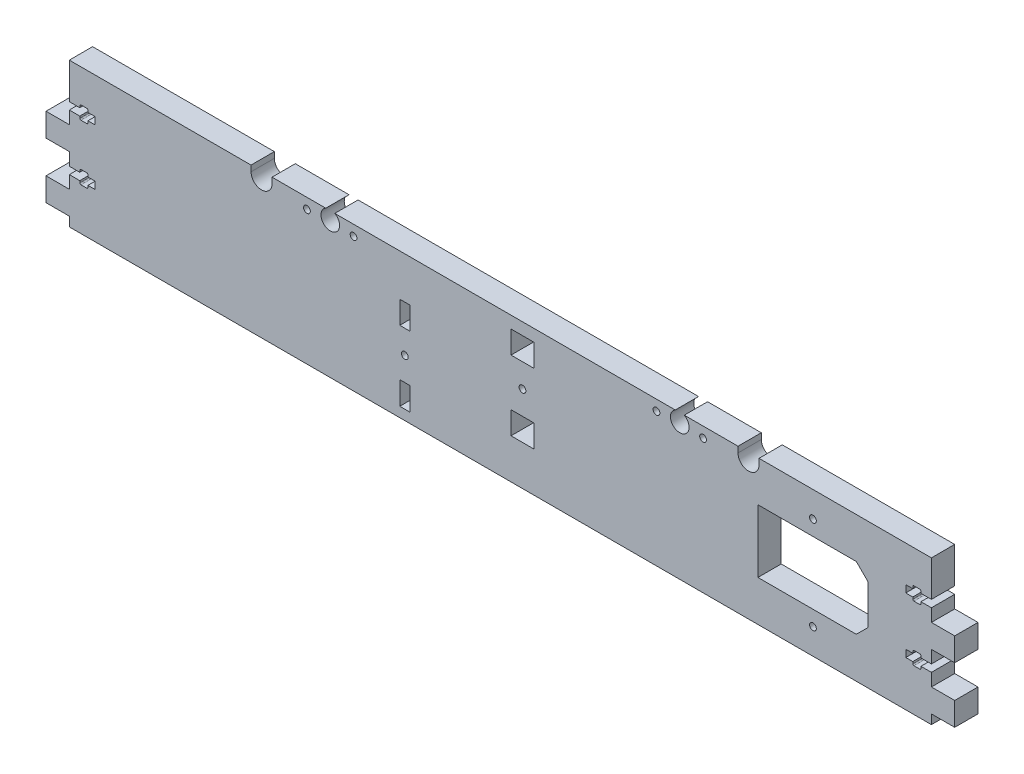
from build123d import *

# Parameters (mm, degrees)
MAINBODY_DEPTH      = 10
SCREWCUTOUTS_DEPTH  = 205.863369102
SKETCH2_R           = 4
SKETCH2_R_2         = 1.45
RODCUTOUTS_DEPTH    = 205.863369102
SKETCH4_R           = 1.45
SKETCH4_W           = 9.85
SKETCH4_H           = 9.7
CUT_EXTRUDE3_DEPTH  = 205.863369102
SKETCH5_R           = 1.45
SKETCH5_W           = 4.35
SKETCH5_H           = 9.7
SKETCH5_H_2         = 9.9
ENDSTOPHOLDER_DEPTH = 205.863369102
CUT_EXTRUDE4_DEPTH  = 205.863369102
CUT_EXTRUDE5_DEPTH  = 205.863369102
SKETCH9_R           = 1.45
CUT_EXTRUDE6_DEPTH  = 205.863369102


with BuildPart() as part:
    # Sketch1 → MainBody (new body)
    with BuildSketch(Plane.XY):
        Polygon((0, 0), (-185, 0), (-185, -24), (-195, -24), (-195, -34), (-185, -34), (-185, -48), (-195, -48), (-195, -58), (-185, -58), (-185, -62), (0, -62), align=None)
    mainbody = extrude(amount=MAINBODY_DEPTH)

    # Sketch3 → ScrewCutouts (cut, through all)
    with BuildSketch(Plane.XY.offset(10)):
        with BuildLine():
            Line((-185, -18.55), (-180.5, -18.55))
            Line((-180.5, -18.55), (-180.5, -19.35))
            ThreePointArc((-180.5, -19.35), (-180.353553391, -19.703553391), (-180, -19.85))
            Line((-180, -19.85), (-177.5, -19.85))
            ThreePointArc((-177.5, -19.85), (-177.146446609, -19.703553391), (-177, -19.35))
            Line((-177, -19.35), (-177, -18.55))
            Line((-177, -18.55), (-174, -18.55))
            Line((-174, -18.55), (-174, -15.45))
            Line((-174, -15.45), (-177, -15.45))
            Line((-177, -15.45), (-177, -14.65))
            ThreePointArc((-177, -14.65), (-177.146446609, -14.296446609), (-177.5, -14.15))
            Line((-177.5, -14.15), (-180, -14.15))
            ThreePointArc((-180, -14.15), (-180.353553391, -14.296446609), (-180.5, -14.65))
            Line((-180.5, -14.65), (-180.5, -15.45))
            Line((-180.5, -15.45), (-185, -15.45))
            Line((-185, -15.45), (-185, -18.55))
        make_face()
        with BuildLine():
            Line((-185, -39.45), (-185, -42.55))
            Line((-185, -42.55), (-180.5, -42.55))
            Line((-180.5, -42.55), (-180.5, -43.35))
            ThreePointArc((-180.5, -43.35), (-180.353553391, -43.703553391), (-180, -43.85))
            Line((-180, -43.85), (-177.5, -43.85))
            ThreePointArc((-177.5, -43.85), (-177.146446609, -43.703553391), (-177, -43.35))
            Line((-177, -43.35), (-177, -42.55))
            Line((-177, -42.55), (-174, -42.55))
            Line((-174, -42.55), (-174, -39.45))
            Line((-174, -39.45), (-177, -39.45))
            Line((-177, -39.45), (-177, -38.65))
            ThreePointArc((-177, -38.65), (-177.146446609, -38.296446609), (-177.5, -38.15))
            Line((-177.5, -38.15), (-180, -38.15))
            ThreePointArc((-180, -38.15), (-180.353553391, -38.296446609), (-180.5, -38.65))
            Line((-180.5, -38.65), (-180.5, -39.45))
            Line((-180.5, -39.45), (-185, -39.45))
        make_face()
    screwcutouts = extrude(amount=-SCREWCUTOUTS_DEPTH, mode=Mode.SUBTRACT)

    # Mirror1: MainBody, ScrewCutouts across plane
    add(mainbody.mirror(Plane(origin=(0, 0, 0), x_dir=(0, 0, 1), z_dir=(1, 0, 0))))
    add(screwcutouts.mirror(Plane(origin=(0, 0, 0), x_dir=(0, 0, 1), z_dir=(1, 0, 0))), mode=Mode.SUBTRACT)

    # Sketch2 → RodCutouts (cut, through all)
    with BuildSketch(Plane.XY.offset(10)):
        with Locations((-73, -3.5)):
            Circle(SKETCH2_R)
        with Locations((-83, -4.5)):
            Circle(SKETCH2_R_2)
        with Locations((-63, -4.5)):
            Circle(SKETCH2_R_2)
        with Locations((67, -4.5)):
            Circle(SKETCH2_R_2)
        with Locations((87, -4.5)):
            Circle(SKETCH2_R_2)
        with Locations((77, -3.5)):
            Circle(SKETCH2_R)
    extrude(amount=-RODCUTOUTS_DEPTH, mode=Mode.SUBTRACT)

    # Sketch4 → Cut-Extrude3 (cut, through all)
    with BuildSketch(Plane.XY.offset(10)):
        with Locations((9.5, -25)):
            Circle(SKETCH4_R)
        with Locations((9.5, -10)):
            Rectangle(SKETCH4_W, SKETCH4_H)
        with Locations((9.5, -40)):
            Rectangle(SKETCH4_W, SKETCH4_H)
    extrude(amount=-CUT_EXTRUDE3_DEPTH, mode=Mode.SUBTRACT)

    # Sketch5 → EndstopHolder (cut, through all)
    with BuildSketch(Plane.XY.offset(10)):
        with Locations((-41, -37.75)):
            Circle(SKETCH5_R)
        with Locations((-41, -22.8)):
            Rectangle(SKETCH5_W, SKETCH5_H)
        with Locations((-41, -52.8)):
            Rectangle(SKETCH5_W, SKETCH5_H_2)
        with BuildLine():
            Line((-31.425, 8.994431211), (-31.425, 5))
            ThreePointArc((-31.425, 5), (-34.625, 1.8), (-37.825, 5))
            Line((-37.825, 5), (-37.825, 8.994431211))
            ThreePointArc((-37.825, 8.994431211), (-34.625, 12.194431211), (-31.425, 8.994431211))
        make_face()
    extrude(amount=-ENDSTOPHOLDER_DEPTH, mode=Mode.SUBTRACT)

    # Sketch7 → Cut-Extrude4 (cut, through all)
    with BuildSketch(Plane.XY.offset(10)):
        with BuildLine():
            Line((-98, 0), (-98, -2.5))
            ThreePointArc((-98, -2.5), (-102.5, -7), (-107, -2.5))
            Line((-107, -2.5), (-107, 0))
            ThreePointArc((-107, 0), (-102.5, 4.5), (-98, 0))
        make_face()
        with BuildLine():
            Line((102, 0), (102, -2.5))
            ThreePointArc((102, -2.5), (106.5, -7), (111, -2.5))
            Line((111, -2.5), (111, 0))
            ThreePointArc((111, 0), (106.5, 4.5), (102, 0))
        make_face()
    extrude(amount=-CUT_EXTRUDE4_DEPTH, mode=Mode.SUBTRACT)

    # Sketch8 → Cut-Extrude5 (cut, through all)
    with BuildSketch(Plane.XY.offset(10)):
        Polygon((110.536074356, -17.485), (110.536074356, -44.515), (152.786074356, -44.515), (157.786074356, -39.515), (157.786074356, -22.485), (152.786074356, -17.485), align=None)
    extrude(amount=-CUT_EXTRUDE5_DEPTH, mode=Mode.SUBTRACT)

    # Sketch9 → Cut-Extrude6 (cut, through all)
    with BuildSketch(Plane(origin=(0, 0, 0), x_dir=(-1, 0, 0), z_dir=(0, 0, -1))):
        with Locations((-134.161074356, -11)):
            Circle(SKETCH9_R)
        with Locations((-134.161074356, -51)):
            Circle(SKETCH9_R)
    extrude(amount=-CUT_EXTRUDE6_DEPTH, mode=Mode.SUBTRACT)


solid = part.part
